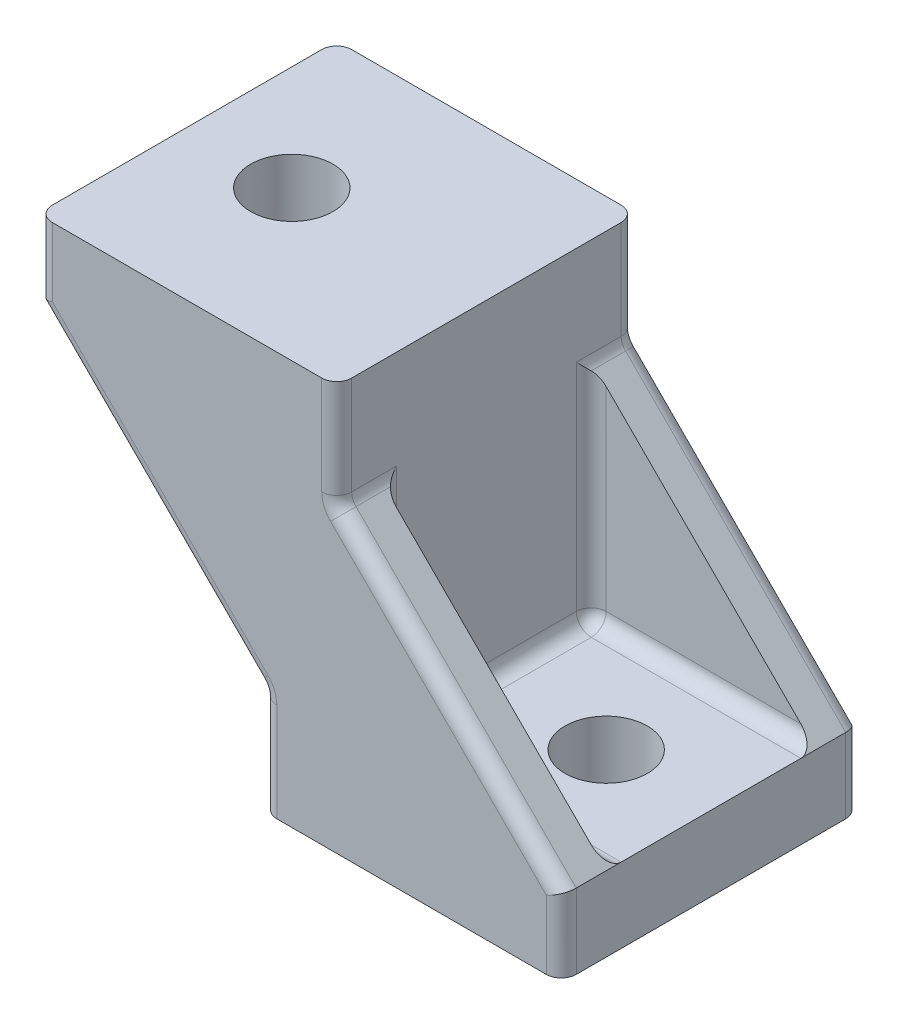
from build123d import *

# Parameters (mm, degrees)
BOSS_EXTRUDE1_DEPTH = 10
SKETCH2_R           = 2.75
CUT_EXTRUDE1_DEPTH  = 36.057096286
SKETCH3_R           = 2.75
CUT_EXTRUDE2_DEPTH  = 32.368774283
RIB7_REACH          = 41.102
SKETCH5_WALL_W      = 101.41806262
SKETCH5_WALL_H      = 3
RIB8_REACH          = 41.102
SKETCH6_WALL_W      = 101.41806262
SKETCH6_WALL_H      = 3
FILLET1_R           = 1
FILLET2_R           = 1


with BuildPart() as part:
    # Sketch1 → Boss-Extrude1 (new, symmetric)
    with BuildSketch(Plane.XY):
        Polygon((0, 0), (0, 22), (-15, 22), (-15, 27), (5, 27), (5, 5), (20, 5), (20, 0), align=None)
    extrude(amount=BOSS_EXTRUDE1_DEPTH, both=True)

    # Sketch2 → Cut-Extrude1 (cut, through all)
    with BuildSketch(Plane(origin=(0, 27, 0), x_dir=(1, 0, 0), z_dir=(0, 1, 0))):
        with Locations((-8, 0)):
            Circle(SKETCH2_R)
    extrude(amount=-CUT_EXTRUDE1_DEPTH, mode=Mode.SUBTRACT)

    # Sketch3 → Cut-Extrude2 (cut, through all)
    with BuildSketch(Plane(origin=(0, 5, 0), x_dir=(1, 0, 0), z_dir=(0, 1, 0))):
        with Locations((13, 0)):
            Circle(SKETCH3_R)
    extrude(amount=-CUT_EXTRUDE2_DEPTH, mode=Mode.SUBTRACT)

    # Sketch5 wall → Rib7 (add, up to next)
    with BuildSketch(Plane(origin=(12.5, 12.5, -10), x_dir=(-0.707106781187, 0.707106781187, 0), z_dir=(0.707106781187, 0.707106781187, 0)), mode=Mode.PRIVATE) as rib7_sk1:
        with Locations((0, 1.5)):
            Rectangle(SKETCH5_WALL_W, SKETCH5_WALL_H)
    rib7_tool1 = extrude(rib7_sk1.sketch, amount=-RIB7_REACH, mode=Mode.PRIVATE) - part.part
    rib7 = rib7_tool1.solids().sort_by_distance((12.5, 12.5, -10))[0]
    add(rib7)

    # Sketch6 wall → Rib8 (add, up to next)
    with BuildSketch(Plane(origin=(-7.5, 14.5, -10), x_dir=(0.707106781187, -0.707106781187, 0), z_dir=(-0.707106781187, -0.707106781187, 0)), mode=Mode.PRIVATE) as rib8_sk1:
        with Locations((0, 1.5)):
            Rectangle(SKETCH6_WALL_W, SKETCH6_WALL_H)
    rib8_tool1 = extrude(rib8_sk1.sketch, amount=-RIB8_REACH, mode=Mode.PRIVATE) - part.part
    rib8 = rib8_tool1.solids().sort_by_distance((-7.5, 14.5, -10))[0]
    add(rib8)

    # Mirror1: Rib7, Rib8 across plane
    add(rib7.mirror(Plane.XY))
    add(rib8.mirror(Plane.XY))

    # Fillet1
    fillet1_edges = [part.edges().sort_by_distance(p)[0] for p in [
        (0, 7, 8.5),
        (0, 7, -8.5),
        (5, 20, -8.5),
        (5, 20, 8.5),
        (5, 12.5, -7),
        (12.5, 5, -7),
        (12.5, 5, 7),
        (5, 12.5, 7),
        (5, 5, 0),
        (0, 22, 0),
        (0, 14.5, -7),
        (0, 14.5, 7),
        (-7.5, 22, 7),
        (-7.5, 22, -7),
    ]]
    fillet(fillet1_edges, radius=FILLET1_R)

    # Fillet2
    fillet2_edges = [part.edges().sort_by_distance(p)[0] for p in [
        (-7.646446609, 14.646446609, -10),
        (-0.076120467, 6.96846987, -10),
        (-7.646446609, 14.646446609, 10),
        (-0.076120467, 6.96846987, 10),
        (12.646446609, 12.353553391, 10),
        (5.076120467, 20.03153013, 10),
        (12.646446609, 12.353553391, -10),
        (5.076120467, 20.03153013, -10),
        (0, 3.292893219, -10),
        (0, 3.292893219, 10),
        (5, 23.707106781, 10),
        (5, 23.707106781, -10),
        (20, 2.5, -10),
        (20, 2.5, 10),
        (-15, 24.5, 10),
        (-15, 24.5, -10),
    ]]
    fillet(fillet2_edges, radius=FILLET2_R)


solid = part.part
